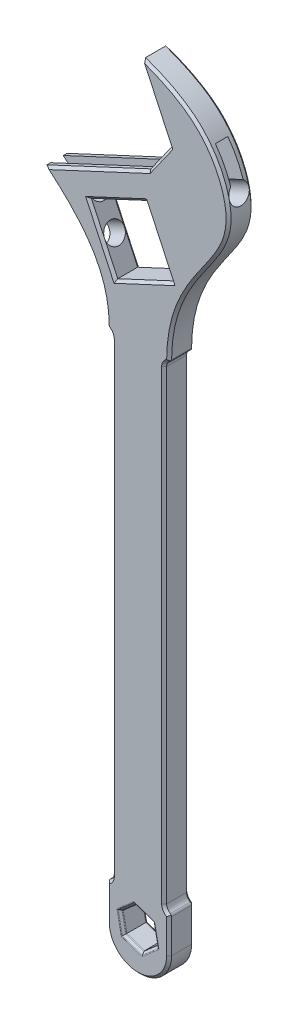
from build123d import *

# Parameters (mm, degrees)
BOSS_EXTRUDE1_DEPTH     = 5
CUT_EXTRUDE1_DEPTH      = 70
CUT_EXTRUDE1_DEPTH_BACK = 5
SKETCH4_R               = 4
SKETCH5_R               = 4
SKETCH5_W               = 5
SKETCH5_H               = 15
CUT_EXTRUDE2_DEPTH      = 87.5
CHAMFER1_SIZE           = 1
FILLET1_R               = 1
FILLET3_R               = 0.5
FILLET4_R               = 0.5
FILLET5_R               = 0.5


with BuildPart() as part:
    # Sketch1 → Boss-Extrude1 (new, symmetric)
    with BuildSketch(Plane.XY):
        with BuildLine():
            Line((0, 7.671573587), (0, -6.519014224))
            ThreePointArc((0, -6.519014224), (12.500000523, -19.019014747), (25.000001046, -6.519014224))
            Line((25.000001046, -6.519014224), (25.000001046, 7.671573587))
            ThreePointArc((25.000001046, 7.671573587), (23.550511303, 8.767949905), (23.000001046, 10.500000712))
            Line((23.000001046, 10.500000712), (23.000001046, 197.171573064))
            ThreePointArc((23.000001046, 197.171573064), (23.550511303, 198.903623872), (25.000001046, 200.000000189))
            add(Edge.make_bspline(
                [(14.586823683, 300.379136588), (20.851441155, 298.099002299), (40.227784441, 290.055255672), (59.440804601, 245.881520345), (25.000001046, 233.333333523), (25.000001046, 200.000000189)],
                knots=[0, 0, 0, 0, 0.205207238, 0.454414123, 1, 1, 1, 1], degree=3))
            Line((14.586823683, 300.379136588), (25.99751675, 275.908826338))
            Line((25.99751675, 275.908826338), (16.687644041, 262.740538045))
            Line((16.687644041, 262.740538045), (-25, 243.301270378))
            add(Edge.make_bspline(
                [(0, 200.000000189), (0, 216.666666856), (-7.125629661, 228.302892819), (-25, 243.301270378)],
                knots=[0, 0, 0, 0, 1, 1, 1, 1], degree=3))
            ThreePointArc((0, 200.000000189), (1.449489743, 198.903623872), (2, 197.171573064))
            Line((2, 197.171573064), (2, 10.500000712))
            ThreePointArc((2, 10.500000712), (1.449489743, 8.767949905), (0, 7.671573587))
        make_face()
        Polygon((-7.179200577, 240.577466434), (3.386255966, 217.919771758), (26.043950642, 228.485228302), (15.478494099, 251.142922978), align=None, mode=Mode.SUBTRACT)
        Polygon((13.958692431, -10.362441935), (19.605408227, -5.417956719), (18.146716319, 1.944485216), (11.041308615, 4.362441935), (5.394592819, -0.582043281), (6.853284727, -7.944485216), align=None, mode=Mode.SUBTRACT)
    extrude(amount=BOSS_EXTRUDE1_DEPTH, both=True)

    # Sketch4 → Cut-Extrude1 (cut, two sides: drawn at the far end of the back side and taken through both)
    with BuildSketch(Plane(origin=(108.907259449, 50.78428911, 0), x_dir=(0, 0, 1), z_dir=(-0.9063077870366524, -0.4226182617406942, 0)).offset(-CUT_EXTRUDE1_DEPTH_BACK)):
        with Locations(Location((0, 208.571292483, 0), (0, 0, 270))):
            Circle(SKETCH4_R)
    extrude(amount=CUT_EXTRUDE1_DEPTH + CUT_EXTRUDE1_DEPTH_BACK, mode=Mode.SUBTRACT)

    # Sketch5 → Cut-Extrude2 (cut, symmetric)
    with BuildSketch(Plane(origin=(127.033410812, 59.236652303, 0), x_dir=(0, 0, 1), z_dir=(-0.9063077870366527, -0.42261826174069383, 0))):
        with Locations((0, 222.571292483)):
            Circle(SKETCH5_R)
        with Locations((0, 231.571292483)):
            Rectangle(SKETCH5_W, SKETCH5_H)
    extrude(amount=CUT_EXTRUDE2_DEPTH, both=True, mode=Mode.SUBTRACT)

    # Chamfer1
    chamfer1_edges = [part.edges().sort_by_distance(p)[0] for p in [
        (2, 103.835786888, -5),
        (2, 103.835786888, 5),
        (1.449489743, 198.903623872, -5),
        (1.449489743, 198.903623872, 5),
        (-5.797111123, 222.276243699, 5),
        (-1.896472305, 229.248619096, 5),
        (-1.896472305, 229.248619096, -5),
        (14.715103304, 223.20250003, -5),
        (14.715103304, 223.20250003, 5),
        (20.761222371, 239.81407564, 5),
        (20.761222371, 239.81407564, -5),
        (4.149646761, 245.860194706, 5),
        (4.149646761, 245.860194706, -5),
        (48.341586655, 256.569837572, 5),
        (20.292170217, 288.143981463, -5),
        (21.342580396, 269.324682191, 5),
        (21.342580396, 269.324682191, -5),
        (-4.156177979, 253.020904212, -5),
        (23.550511303, 198.903623872, -5),
        (23.550511303, 198.903623872, 5),
        (23.000001046, 103.835786888, -5),
        (23.000001046, 103.835786888, 5),
        (23.550511303, 8.767949905, -5),
        (23.550511303, 8.767949905, 5),
        (25.000001046, 0.576279682, -5),
        (25.000001046, 0.576279682, 5),
        (12.500000523, -19.019014747, -5),
        (12.500000523, -19.019014747, 5),
        (0, 0.576279682, -5),
        (0, 0.576279682, 5),
        (48.341586655, 256.569837572, -5),
        (-4.156177979, 253.020904212, 5),
        (-5.797111123, 222.276243699, -5),
        (1.449489743, 8.767949905, 5),
        (10.405988579, -9.153463576, 5),
        (6.123938773, -4.263264249, 5),
        (8.217950717, 1.890199327, 5),
        (14.594012467, 3.153463576, 5),
        (18.876062273, -1.736735751, 5),
        (16.782050329, -7.890199327, 5),
        (16.782050329, -7.890199327, -5),
        (18.876062273, -1.736735751, -5),
        (14.594012467, 3.153463576, -5),
        (8.217950717, 1.890199327, -5),
        (6.123938773, -4.263264249, -5),
        (10.405988579, -9.153463576, -5),
        (1.449489743, 8.767949905, -5),
    ]]
    chamfer(chamfer1_edges, length=CHAMFER1_SIZE - 0.0001)  # a hair under: the kernel refuses the full size

    # Fillet1
    fillet1_edges = [part.edges().sort_by_distance(p)[0] for p in [
        (25.000001046, 200.000000189, 2.00005),
        (0, 200.000000189, -2.00005),
        (0, 7.671573587, 0),
        (25.000001046, 7.671573587, 0),
    ]]
    fillet(fillet1_edges, radius=FILLET1_R)

    # Fillet3
    fillet3_edges = [part.edges().sort_by_distance(p)[0] for p in [
        (10.405988579, -9.153463576, 4.0001),
    ]]
    fillet(fillet3_edges, radius=FILLET3_R)
    fillet3_2_edges = [part.edges().sort_by_distance(p)[0] for p in [
        (6.128978008, -4.288698733, 4.0001),
    ]]
    fillet(fillet3_2_edges, radius=FILLET3_R)
    fillet3_3_edges = [part.edges().sort_by_distance(p)[0] for p in [
        (8.198443425, 1.873117979, 4.0001),
    ]]
    fillet(fillet3_3_edges, radius=FILLET3_R)
    fillet3_4_edges = [part.edges().sort_by_distance(p)[0] for p in [
        (14.56946594, 3.161816712, 4.0001),
    ]]
    fillet(fillet3_4_edges, radius=FILLET3_R)
    fillet3_5_edges = [part.edges().sort_by_distance(p)[0] for p in [
        (16.762543037, -7.907280675, 4.0001),
    ]]
    fillet(fillet3_5_edges, radius=FILLET3_R)

    # Fillet4
    fillet4_edges = [part.edges().sort_by_distance(p)[0] for p in [
        (6.123938773, -4.263264249, -4.0001),
        (8.217950717, 1.890199327, -4.0001),
        (14.594012467, 3.153463576, -4.0001),
        (18.876062273, -1.736735751, -4.0001),
        (16.782050329, -7.890199327, -4.0001),
        (10.405988579, -9.153463576, -4.0001),
    ]]
    fillet(fillet4_edges, radius=FILLET4_R)

    # Fillet5
    fillet5_edges = [part.edges().sort_by_distance(p)[0] for p in [
        (10.083865111, -10.100055611, -5),
        (17.440761344, -8.642462451, -5),
        (19.856896756, -1.54240684, -5),
        (14.916135935, 4.100055611, -5),
        (7.559239701, 2.642462451, -5),
        (5.143104289, -4.45759316, -5),
        (17.440761344, -8.642462451, 5),
        (19.856896756, -1.54240684, 5),
        (14.916135935, 4.100055611, 5),
        (7.559239701, 2.642462451, 5),
        (5.143104289, -4.45759316, 5),
        (10.083865111, -10.100055611, 5),
    ]]
    fillet(fillet5_edges, radius=FILLET5_R)


solid = part.part
